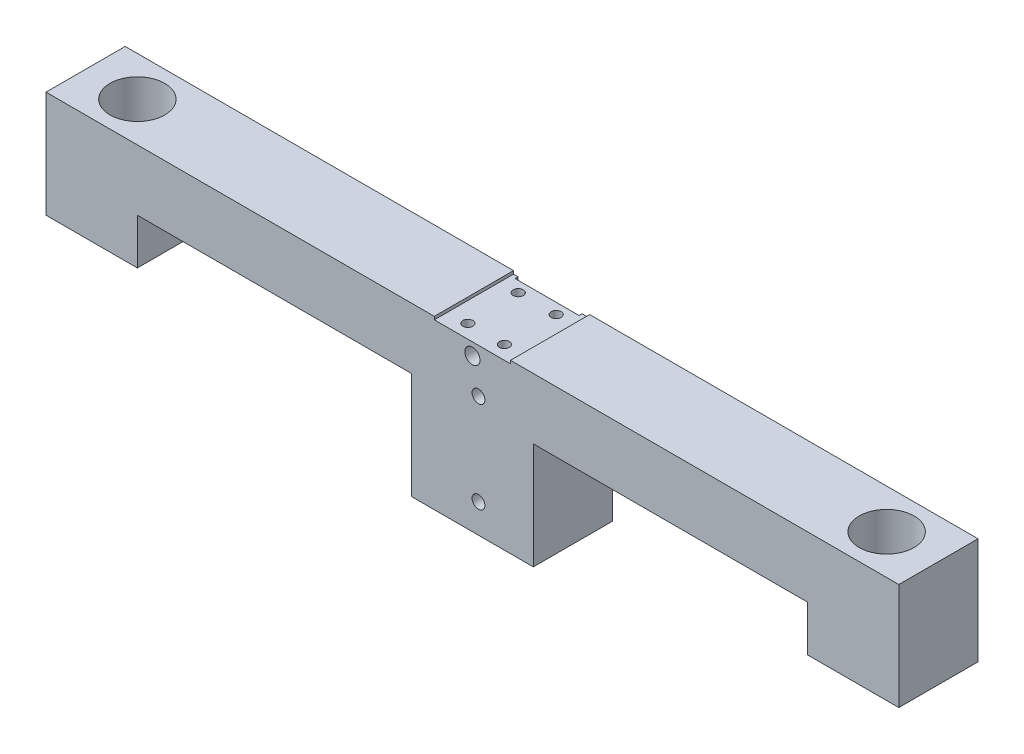
from build123d import *

# Parameters (mm, degrees)
SKETCH_1_W             = 280
SKETCH_1_H             = 35
EXTRUDE_1_DEPTH        = 26
SKETCH_3_R             = 9
CUT_EXTRUDE_1_DEPTH    = 284.374310762
SKETCH_4_W             = 25
SKETCH_4_H             = 26
CUT_EXTRUDE_2_DEPTH    = 1
HOLE_WIZARD_M4_1_D     = 3.3
HOLE_WIZARD_M4_1_DEPTH = 10.1
HOLE_WIZARD_M4_1_TIP   = 0.991420021
SKETCH_7_W             = 220
SKETCH_7_H             = 15
CUT_EXTRUDE_3_DEPTH    = 284.374310762
SKETCH_8_W             = 40
SKETCH_8_H             = 26
EXTRUDE_2_DEPTH        = 35
SKETCH_9_W             = 20
SKETCH_9_H             = 71.26464816
CUT_EXTRUDE_4_DEPTH    = 1
SKETCH_10_R            = 2.5
CUT_EXTRUDE_5_DEPTH    = 284.284309484
SKETCH_12_W            = 1
SKETCH_12_H            = 54
CUT_EXTRUDE_6_DEPTH    = 1
HOLE_WIZARD_M5_1_D     = 4.2


with BuildPart() as part:
    # 草图1 → 凸台-拉伸1 (new body)
    with BuildSketch(Plane.XY):
        with Locations((140, 17.5)):
            Rectangle(SKETCH_1_W, SKETCH_1_H)
    extrude(amount=EXTRUDE_1_DEPTH)

    # 草图3 → 切除-拉伸1 (cut, through all)
    with BuildSketch(Plane.XZ):
        with Locations((17, 13)):
            Circle(SKETCH_3_R)
        with Locations((263, 13)):
            Circle(SKETCH_3_R)
    extrude(amount=-CUT_EXTRUDE_1_DEPTH, mode=Mode.SUBTRACT)

    # 草图4 → 切除-拉伸2 (cut)
    with BuildSketch(Plane(origin=(0, 35, 0), x_dir=(1, 0, 0), z_dir=(0, 1, 0))):
        with Locations((140, -13)):
            Rectangle(SKETCH_4_W, SKETCH_4_H)
    extrude(amount=-CUT_EXTRUDE_2_DEPTH, mode=Mode.SUBTRACT)

    # M4 螺纹孔1
    with Locations(Plane(origin=(0, 34, 0), x_dir=(1, 0, 0), z_dir=(0, 1, 0))):
        with Locations((146, -21.5), (134, -21.5), (146, -4.5), (133.546958493, -4.5)):
            Hole(HOLE_WIZARD_M4_1_D / 2, depth=HOLE_WIZARD_M4_1_DEPTH)
            with Locations((0, 0, -(HOLE_WIZARD_M4_1_DEPTH + HOLE_WIZARD_M4_1_TIP / 2))):  # 118° drill point
                Cone(0, HOLE_WIZARD_M4_1_D / 2, HOLE_WIZARD_M4_1_TIP, mode=Mode.SUBTRACT)

    # 草图7 → 切除-拉伸3 (cut, through all)
    with BuildSketch(Plane.XY.offset(26)):
        with Locations((140, 7.5)):
            Rectangle(SKETCH_7_W, SKETCH_7_H)
    extrude(amount=-CUT_EXTRUDE_3_DEPTH, mode=Mode.SUBTRACT)

    # 草图8 → 凸台-拉伸2 (add)
    with BuildSketch(Plane.XZ.offset(-15)):
        with Locations((140, 13)):
            Rectangle(SKETCH_8_W, SKETCH_8_H)
    extrude(amount=EXTRUDE_2_DEPTH)

    # 草图9 → 切除-拉伸4 (cut)
    with BuildSketch(Plane(origin=(0, 0, 0), x_dir=(-1, 0, 0), z_dir=(0, 0, -1))):
        with Locations((-140, 15.63232408)):
            Rectangle(SKETCH_9_W, SKETCH_9_H)
    extrude(amount=-CUT_EXTRUDE_4_DEPTH, mode=Mode.SUBTRACT)

    # 草图10 → 切除-拉伸5 (cut, through all)
    with BuildSketch(Plane(origin=(0, 0, 1), x_dir=(-1, 0, 0), z_dir=(0, 0, -1))):
        with Locations((-140, 30)):
            Circle(SKETCH_10_R)
    extrude(amount=-CUT_EXTRUDE_5_DEPTH, mode=Mode.SUBTRACT)

    # 草图12 → 切除-拉伸6 (cut)
    with BuildSketch(Plane(origin=(130, 0, 0), x_dir=(0, 0, -1), z_dir=(1, 0, 0))):
        with Locations((-0.5, 7)):
            Rectangle(SKETCH_12_W, SKETCH_12_H)
    extrude(amount=-CUT_EXTRUDE_6_DEPTH, mode=Mode.SUBTRACT)

    # M5 螺纹孔1 (through all)
    with Locations(Plane(origin=(0, 0, 1), x_dir=(-1, 0, 0), z_dir=(0, 0, -1))):
        with Locations((-142, -10.5), (-142, 19.5)):
            Hole(HOLE_WIZARD_M5_1_D / 2)


solid = part.part
